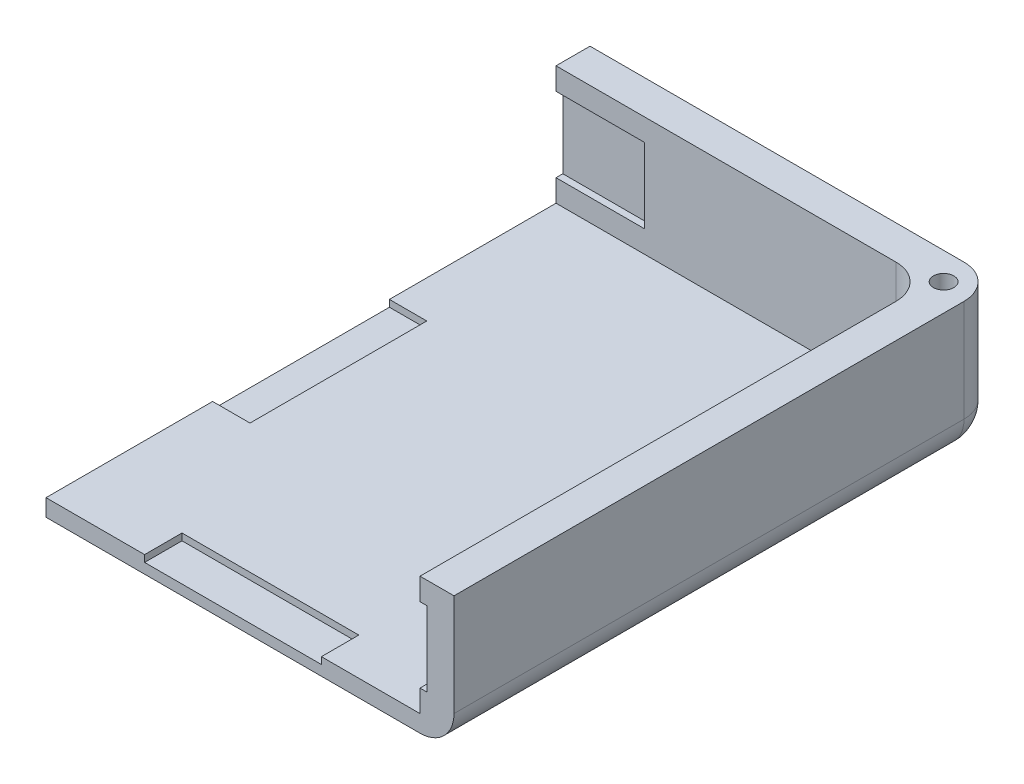
from build123d import *

# Parameters (mm, degrees)
ESQUISSE1_W             = 120
ESQUISSE1_H             = 160
BOSS_EXTRU_1_DEPTH      = 40
CONG_1_R                = 10
CONG_2_R                = 10
ESQUISSE2_W             = 110
ESQUISSE2_H             = 150
ENL_V_MAT_EXTRU_1_DEPTH = 35
CONG_3_R                = 10
ESQUISSE3_R             = 3
ENL_V_MAT_EXTRU_2_DEPTH = 35
ESQUISSE4_R             = 2.5
BOSS_EXTRU_2_DEPTH      = 2.5
CONG_4_R                = 2.5
ESQUISSE5_W             = 11
ESQUISSE5_H             = 52
ESQUISSE5_W_2           = 52
ESQUISSE5_H_2           = 11
ENL_V_MAT_EXTRU_3_DEPTH = 2
ESQUISSE6_W             = 26
ESQUISSE6_H             = 22
ENL_V_MAT_EXTRU_4_DEPTH = 2
ESQUISSE7_W             = 26
ESQUISSE7_H             = 22
ENL_V_MAT_EXTRU_5_DEPTH = 2


with BuildPart() as part:
    # Esquisse1 → Boss.-Extru.1 (new body)
    with BuildSketch(Plane(origin=(0, 0, 0), x_dir=(1, 0, 0), z_dir=(0, 1, 0))):
        with Locations((60, 80)):
            Rectangle(ESQUISSE1_W, ESQUISSE1_H)
    extrude(amount=BOSS_EXTRU_1_DEPTH)

    # Congé1
    cong_1_edges = [part.edges().sort_by_distance(p)[0] for p in [
        (60, 0, -160),
    ]]
    fillet(cong_1_edges, radius=CONG_1_R)

    # Congé2
    cong_2_edges = [part.edges().sort_by_distance(p)[0] for p in [
        (120, 2.928932188, -157.071067812),
        (120, 0, -75),
        (120, 25, -160),
    ]]
    fillet(cong_2_edges, radius=CONG_2_R)

    # Esquisse2 → Enlèv. mat.-Extru.1 (cut)
    with BuildSketch(Plane(origin=(0, 40, 0), x_dir=(1, 0, 0), z_dir=(0, 1, 0))):
        with Locations((55, 75)):
            Rectangle(ESQUISSE2_W, ESQUISSE2_H)
    extrude(amount=-ENL_V_MAT_EXTRU_1_DEPTH, mode=Mode.SUBTRACT)

    # Congé3
    cong_3_edges = [part.edges().sort_by_distance(p)[0] for p in [
        (110, 22.5, -150),
    ]]
    fillet(cong_3_edges, radius=CONG_3_R)

    # Esquisse3 → Enlèv. mat.-Extru.2 (cut)
    with BuildSketch(Plane(origin=(0, 40, 0), x_dir=(1, 0, 0), z_dir=(0, 1, 0))):
        with Locations(Location((112, 152, 0), (0, 0, 270))):
            Circle(ESQUISSE3_R)
    extrude(amount=-ENL_V_MAT_EXTRU_2_DEPTH, mode=Mode.SUBTRACT)

    # Esquisse4 → Boss.-Extru.2 (add)
    with BuildSketch(Plane.XZ):
        with Locations(Location((90, -130, 0), (0, 0, 270))):
            Circle(ESQUISSE4_R)
    extrude(amount=BOSS_EXTRU_2_DEPTH)

    # Congé4
    cong_4_edges = [part.edges().sort_by_distance(p)[0] for p in [
        (90, -2.5, -127.5),
    ]]
    fillet(cong_4_edges, radius=CONG_4_R - 0.0001)  # a hair under: the kernel refuses the full size

    # Esquisse5 → Enlèv. mat.-Extru.3 (cut)
    with BuildSketch(Plane(origin=(0, 5, 0), x_dir=(1, 0, 0), z_dir=(0, 1, 0))):
        with Locations((5.5, 75)):
            Rectangle(ESQUISSE5_W, ESQUISSE5_H)
        with Locations((55, 5.5)):
            Rectangle(ESQUISSE5_W_2, ESQUISSE5_H_2)
    extrude(amount=-ENL_V_MAT_EXTRU_3_DEPTH, mode=Mode.SUBTRACT)

    # Esquisse6 → Enlèv. mat.-Extru.4 (cut)
    with BuildSketch(Plane.XY.offset(-150)):
        with Locations((13, 22.5)):
            Rectangle(ESQUISSE6_W, ESQUISSE6_H)
    extrude(amount=-ENL_V_MAT_EXTRU_4_DEPTH, mode=Mode.SUBTRACT)

    # Esquisse7 → Enlèv. mat.-Extru.5 (cut)
    with BuildSketch(Plane.ZY.offset(-110)):
        with Locations((-13, 22.5)):
            Rectangle(ESQUISSE7_W, ESQUISSE7_H)
    extrude(amount=-ENL_V_MAT_EXTRU_5_DEPTH, mode=Mode.SUBTRACT)


solid = part.part
